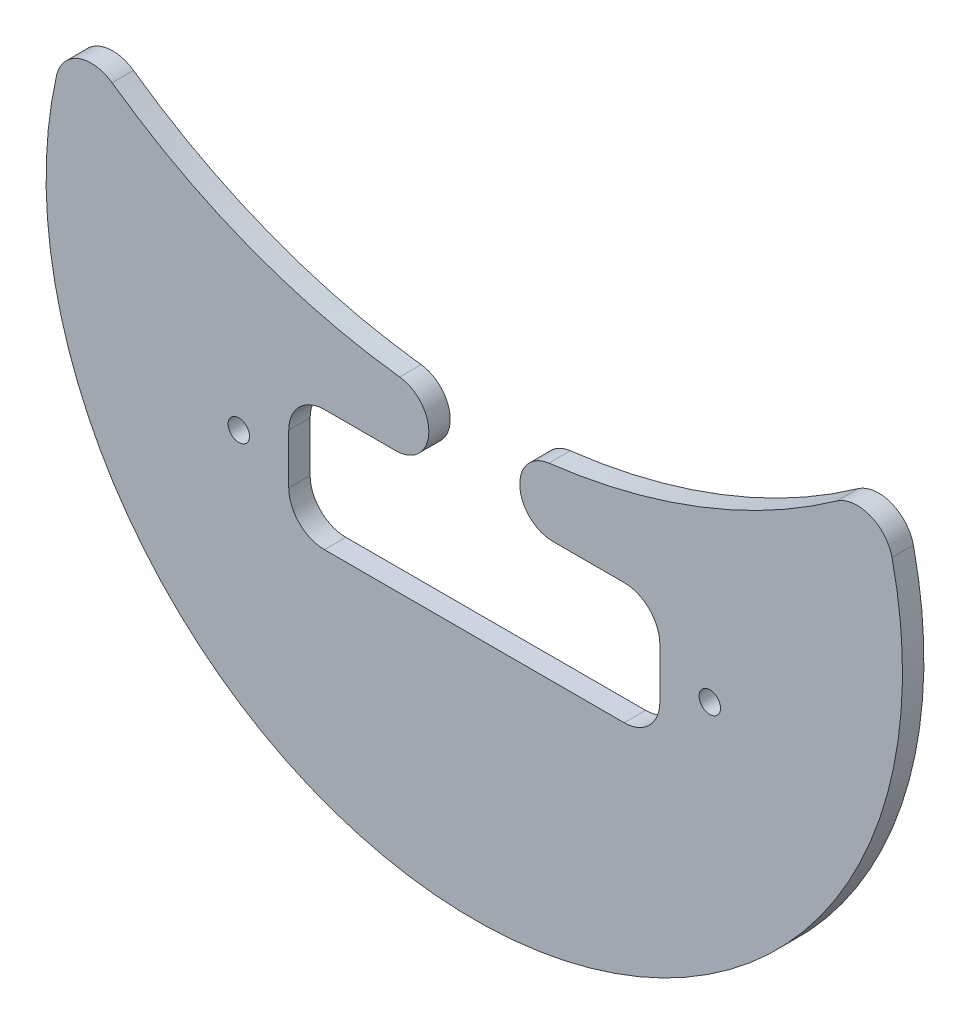
from build123d import *

# Parameters (mm, degrees)
SKETCH1_R           = 1.5
BOSS_EXTRUDE1_DEPTH = 3
FILLET4_R           = 5


with BuildPart() as part:
    # Sketch1 → Boss-Extrude1 (new body)
    with BuildSketch(Plane.XY):
        with BuildLine():
            Line((-25.848592033, 6.75), (26.151407967, 6.75))
            Line((26.151407967, 6.75), (26.151407967, 23.75))
            Line((26.151407967, 23.75), (11.151407967, 23.75))
            ThreePointArc((11.151407967, 23.75), (6.530900978, 28.102570311), (10.600025023, 32.974549649))
            ThreePointArc((10.600025023, 32.974549649), (35.015964593, 39.57666935), (56.532965215, 52.8712086))
            ThreePointArc((56.532965215, 52.8712086), (0.151407967, -27.65), (-56.23014928, 52.8712086))
            ThreePointArc((-56.23014928, 52.8712086), (-34.713148658, 39.57666935), (-10.297209088, 32.974549649))
            ThreePointArc((-10.297209088, 32.974549649), (-6.228085043, 28.102570311), (-10.848592033, 23.75))
            Line((-10.848592033, 23.75), (-25.848592033, 23.75))
            Line((-25.848592033, 23.75), (-25.848592033, 6.75))
        make_face()
        with Locations((-32.848592033, 15.25)):
            Circle(SKETCH1_R, mode=Mode.SUBTRACT)
        with Locations((33.151407967, 15.25)):
            Circle(SKETCH1_R, mode=Mode.SUBTRACT)
    extrude(amount=BOSS_EXTRUDE1_DEPTH)

    # Fillet4
    fillet4_edges = [part.edges().sort_by_distance(p)[0] for p in [
        (-25.848592033, 23.75, 1.5),
        (-25.848592033, 6.75, 1.5),
        (26.151407967, 6.75, 1.5),
        (26.151407967, 23.75, 1.5),
        (-56.23014928, 52.8712086, 1.5),
        (56.532965215, 52.8712086, 1.5),
    ]]
    fillet(fillet4_edges, radius=FILLET4_R)


solid = part.part
